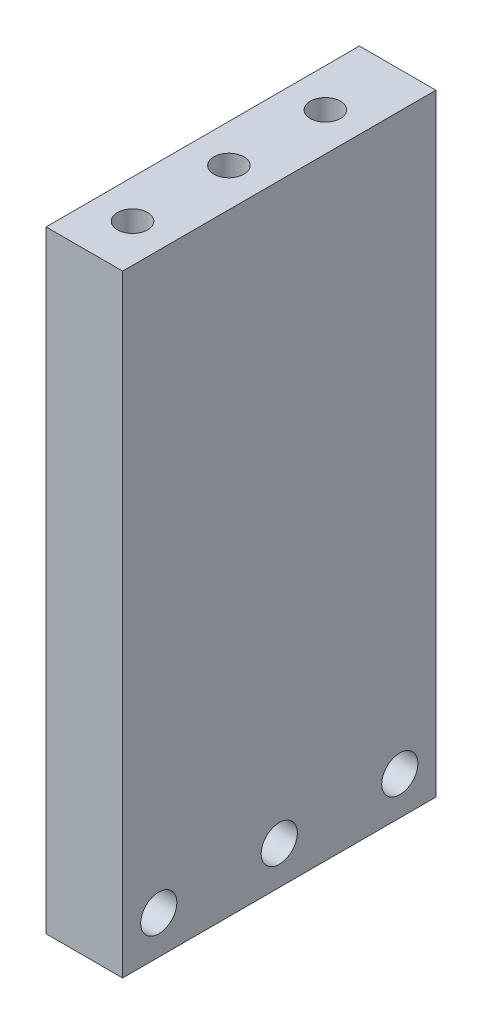
from build123d import *

# Parameters (mm, degrees)
SKETCH1_W           = 6.35
SKETCH1_H           = 50.8
BOSS_EXTRUDE1_DEPTH = 26
SKETCH4_R           = 1.5
CUT_EXTRUDE3_DEPTH  = 6.35
SKETCH6_R           = 1.5
CUT_EXTRUDE5_DEPTH  = 6.35
SKETCH9_R           = 1.25
CUT_EXTRUDE9_DEPTH  = 5
SKETCH12_R          = 1.25
CUT_EXTRUDE10_DEPTH = 5
SKETCH12_3_R        = 1.25
CUT_EXTRUDE11_DEPTH = 5


with BuildPart() as part:
    # Sketch1 → Boss-Extrude1 (new body)
    with BuildSketch(Plane.XY):
        with Locations((3.175, 25.4)):
            Rectangle(SKETCH1_W, SKETCH1_H)
    extrude(amount=BOSS_EXTRUDE1_DEPTH)

    # Sketch4 → Cut-Extrude3 (cut)
    with BuildSketch(Plane(origin=(6.35, 0, 0), x_dir=(0, 0, -1), z_dir=(1, 0, 0))):
        with Locations((-3, 3.175)):
            Circle(SKETCH4_R)
        with Locations((-23, 3.175)):
            Circle(SKETCH4_R)
    extrude(amount=-CUT_EXTRUDE3_DEPTH, mode=Mode.SUBTRACT)

    # Sketch6 → Cut-Extrude5 (cut)
    with BuildSketch(Plane.ZY):
        with Locations((13, 3.175)):
            Circle(SKETCH6_R)
    extrude(amount=-CUT_EXTRUDE5_DEPTH, mode=Mode.SUBTRACT)

    # Sketch9 → Cut-Extrude9 (cut)
    with BuildSketch(Plane(origin=(0, 50.8, 0), x_dir=(1, 0, 0), z_dir=(0, 1, 0))):
        with Locations((3.175, -6)):
            Circle(SKETCH9_R)
    extrude(amount=-CUT_EXTRUDE9_DEPTH, mode=Mode.SUBTRACT)

    # Sketch12 → Cut-Extrude10 (cut)
    with BuildSketch(Plane(origin=(0, 50.8, 0), x_dir=(1, 0, 0), z_dir=(0, 1, 0))):
        with Locations((3.175, -14)):
            Circle(SKETCH12_R)
    extrude(amount=-CUT_EXTRUDE10_DEPTH, mode=Mode.SUBTRACT)

    # Sketch12<3> → Cut-Extrude11 (cut)
    with BuildSketch(Plane(origin=(0, 50.8, 0), x_dir=(1, 0, 0), z_dir=(0, 1, 0))):
        with Locations((3.175, -22)):
            Circle(SKETCH12_3_R)
    extrude(amount=-CUT_EXTRUDE11_DEPTH, mode=Mode.SUBTRACT)


solid = part.part
